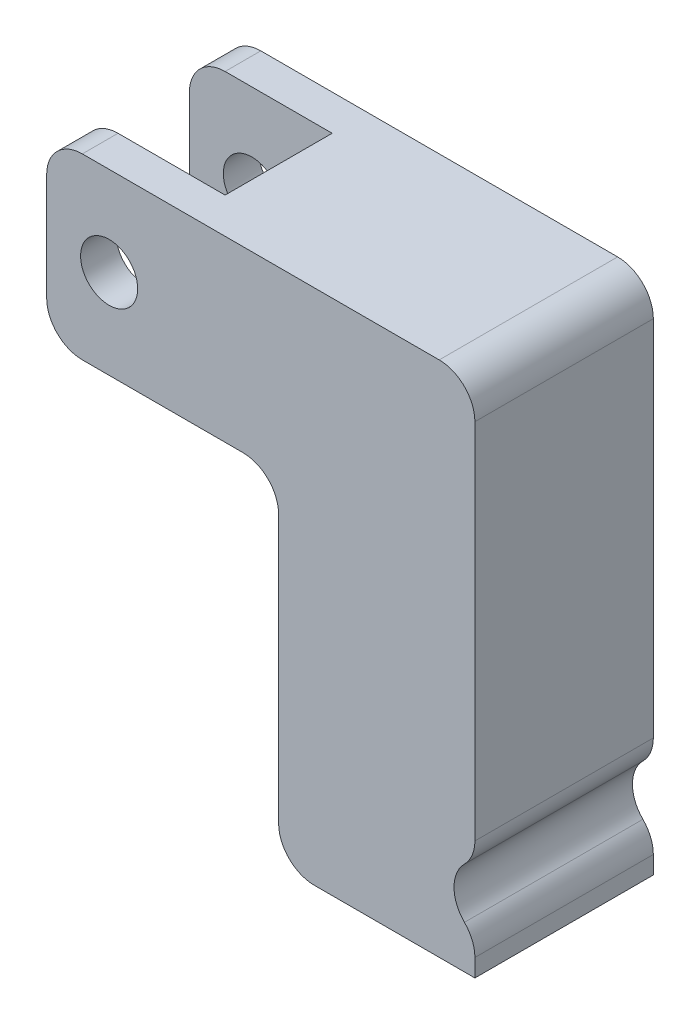
from build123d import *

# Parameters (mm, degrees)
BOSS_EXTRUDE1_DEPTH = 5
SKETCH4_R           = 0.8
CUT_EXTRUDE3_DEPTH  = 20.474342094
SKETCH5_W           = 4
SKETCH5_H           = 3
CUT_EXTRUDE4_DEPTH  = 13
FILLET4_R           = 1
CUT_EXTRUDE5_DEPTH  = 20.474342094
FILLET6_R           = 1
CUT_EXTRUDE6_START  = -8.5
CUT_EXTRUDE6_DEPTH  = 8.002697112
SKETCH11_W          = 3
SKETCH11_H          = 5
CUT_EXTRUDE8_DEPTH  = 4
SKETCH12_R          = 0.6
CUT_EXTRUDE9_DEPTH  = 5
CUT_EXTRUDE10_REACH = 21.474
SKETCH9_R           = 0.25


# Read off the part's stored shape, not the designer's step: Cut-Extrude6
with BuildPart() as part:
    # Sketch1 → Boss-Extrude1 (new body)
    with BuildSketch(Plane.XY):
        Polygon((0, 0), (12, 0), (12, -14.5), (6.5, -14.5), (6.5, -5), (0, -5), align=None)
    extrude(amount=BOSS_EXTRUDE1_DEPTH)

    # Sketch4 → Cut-Extrude3 (cut, through all)
    with BuildSketch(Plane.XY.offset(5)):
        with Locations((1.75, -2.5)):
            Circle(SKETCH4_R)
    extrude(amount=-CUT_EXTRUDE3_DEPTH, mode=Mode.SUBTRACT)

    # Sketch5 → Cut-Extrude4 (cut)
    with BuildSketch(Plane(origin=(0, 0, 0), x_dir=(1, 0, 0), z_dir=(0, 1, 0))):
        with Locations((2, -2.5)):
            Rectangle(SKETCH5_W, SKETCH5_H)
    extrude(amount=-CUT_EXTRUDE4_DEPTH, mode=Mode.SUBTRACT)

    # Fillet4
    fillet4_edges = [part.edges().sort_by_distance(p)[0] for p in [
        (0, 0, 4.5),
        (0, -5, 4.5),
        (0, 0, 0.5),
        (0, -5, 0.5),
    ]]
    fillet(fillet4_edges, radius=FILLET4_R)

    # Sketch6 → Cut-Extrude5 (cut, through all)
    with BuildSketch(Plane.XY.offset(5)):
        Polygon((12, -13.588182425), (11, -12.588182425), (12, -11.588182425), align=None)
    extrude(amount=-CUT_EXTRUDE5_DEPTH, mode=Mode.SUBTRACT)

    # Fillet6
    fillet6_edges = [part.edges().sort_by_distance(p)[0] for p in [
        (11, -12.588182425, 2.5),
        (12, -13.588182425, 2.5),
        (12, -11.588182425, 2.5),
        (6.5, -5, 2.5),
        (6.5, -14.5, 2.5),
        (12, 0, 2.5),
    ]]
    fillet(fillet6_edges, radius=FILLET6_R - 0.0001)  # a hair under: the kernel refuses the full size

    # Cut-Extrude6 outline → Cut-Extrude6 (cut)
    with BuildSketch(Plane.XZ.offset(14.5).offset(CUT_EXTRUDE6_START)):
        with BuildLine():
            Line((6.49999436, 5.000051867), (6.499994078, -5.446e-05))
            ThreePointArc((6.499994078, -5.446e-05), (6.635532303, 2.499998696), (6.49999436, 5.000051867))
        make_face()
    extrude(amount=CUT_EXTRUDE6_DEPTH, mode=Mode.SUBTRACT)

    # Sketch11 → Cut-Extrude8 (cut, along a direction that is not the sketch's normal)
    with BuildSketch(Plane.ZY.offset(-4)):
        with Locations((2.5, -2.5)):
            Rectangle(SKETCH11_W, SKETCH11_H)
    extrude(amount=-CUT_EXTRUDE8_DEPTH, dir=(-0.8191736087025463, 0.5735456379445732, 0), mode=Mode.SUBTRACT)

    # Sketch12 → Cut-Extrude9 (cut, along a direction that is not the sketch's normal)
    with BuildSketch(Plane.ZY.offset(-6.5)):
        with Locations((3.671694189, -8.375443102)):
            Circle(SKETCH12_R)
        with Locations((3.671694189, -10.194652501)):
            Circle(SKETCH12_R)
        with Locations((3.671694189, -12.168032187)):
            Circle(SKETCH12_R)
    extrude(amount=-CUT_EXTRUDE9_DEPTH, dir=(-0.8191736087025463, 0.5735456379445732, 0), mode=Mode.SUBTRACT)

    # Cut-Extrude10: up to this plane
    cut_extrude10_end = Plane(origin=(7.276694435, -7.294182552, 1), z_dir=(-0.5735456379445732, -0.8191736087025463, 0))
    # Sketch9 → Cut-Extrude10 (cut, up to the surface)
    with BuildSketch(Plane.XZ.offset(14.5), mode=Mode.PRIVATE) as cut_extrude10_sk1:
        with Locations((6.635532303, 2.5)):
            Circle(SKETCH9_R)
    cut_extrude10_tool1 = split(extrude(cut_extrude10_sk1.sketch, amount=-CUT_EXTRUDE10_REACH, mode=Mode.PRIVATE), bisect_by=cut_extrude10_end, keep=Keep.BOTH, mode=Mode.PRIVATE)
    add(cut_extrude10_tool1.solids().sort_by_distance((6.635532, -14.5, 2.5))[0], mode=Mode.SUBTRACT)


solid = part.part
